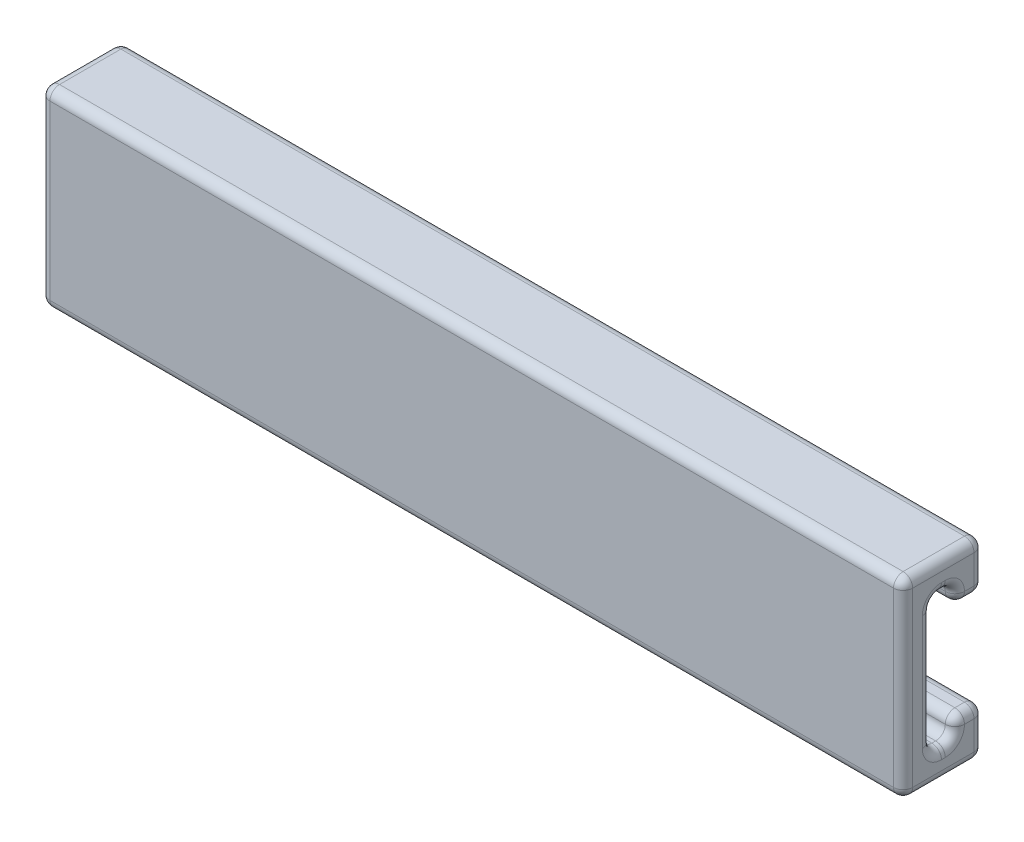
from build123d import *

# Parameters (mm, degrees)
BOSS_EXTRUDE1_DEPTH = 114.3
FILLET1_R           = 1.27
FILLET2_R           = 1.27


with BuildPart() as part:
    # Sketch1 → Boss-Extrude1 (new body)
    with BuildSketch(Plane(origin=(0, 0, 0), x_dir=(0, 0, -1), z_dir=(1, 0, 0))):
        Polygon((0, 8.89), (0, -8.89), (3.048, -8.89), (3.048, -6.35), (6.858, -6.35), (6.858, -12.7), (-3.81, -12.7), (-3.81, 12.7), (6.858, 12.7), (6.858, 6.35), (3.048, 6.35), (3.048, 8.89), align=None)
    extrude(amount=BOSS_EXTRUDE1_DEPTH)

    # Fillet1
    fillet1_edges = [part.edges().sort_by_distance(p)[0] for p in [
        (57.15, 8.89, 0),
        (57.15, -8.89, 0),
        (57.15, -8.89, -3.048),
        (57.15, 8.89, -3.048),
    ]]
    fillet(fillet1_edges, radius=FILLET1_R)

    # Fillet2
    fillet2_edges = [part.edges().sort_by_distance(p)[0] for p in [
        (57.15, 6.35, -3.048),
        (57.15, -6.35, -6.858),
        (57.15, 6.35, -6.858),
        (57.15, -6.35, -3.048),
        (0, 8.518025612, -2.676025612),
        (0, 6.35, -4.953),
        (0, 9.525, -6.858),
        (0, -9.525, -6.858),
        (0, -6.35, -4.953),
        (0, -8.518025612, -2.676025612),
        (0, -8.89, -1.524),
        (0, -8.518025612, -0.371974388),
        (0, 0, 0),
        (0, 8.518025612, -0.371974388),
        (0, 8.89, -1.524),
        (57.15, -12.7, -6.858),
        (0, -12.7, -1.524),
        (57.15, -12.7, 3.81),
        (0, 0, 3.81),
        (114.3, -8.518025612, -0.371974388),
        (114.3, -8.89, -1.524),
        (114.3, -8.518025612, -2.676025612),
        (114.3, -6.35, -4.953),
        (114.3, -9.525, -6.858),
        (114.3, -12.7, -1.524),
        (114.3, 0, 3.81),
        (114.3, 9.525, -6.858),
        (114.3, 6.35, -4.953),
        (114.3, 8.518025612, -2.676025612),
        (114.3, 8.89, -1.524),
        (114.3, 8.518025612, -0.371974388),
        (114.3, 0, 0),
        (57.15, 12.7, -6.858),
        (114.3, 12.7, -1.524),
        (57.15, 12.7, 3.81),
        (0, 12.7, -1.524),
    ]]
    fillet(fillet2_edges, radius=FILLET2_R - 0.0001)  # a hair under: the kernel refuses the full size


solid = part.part
